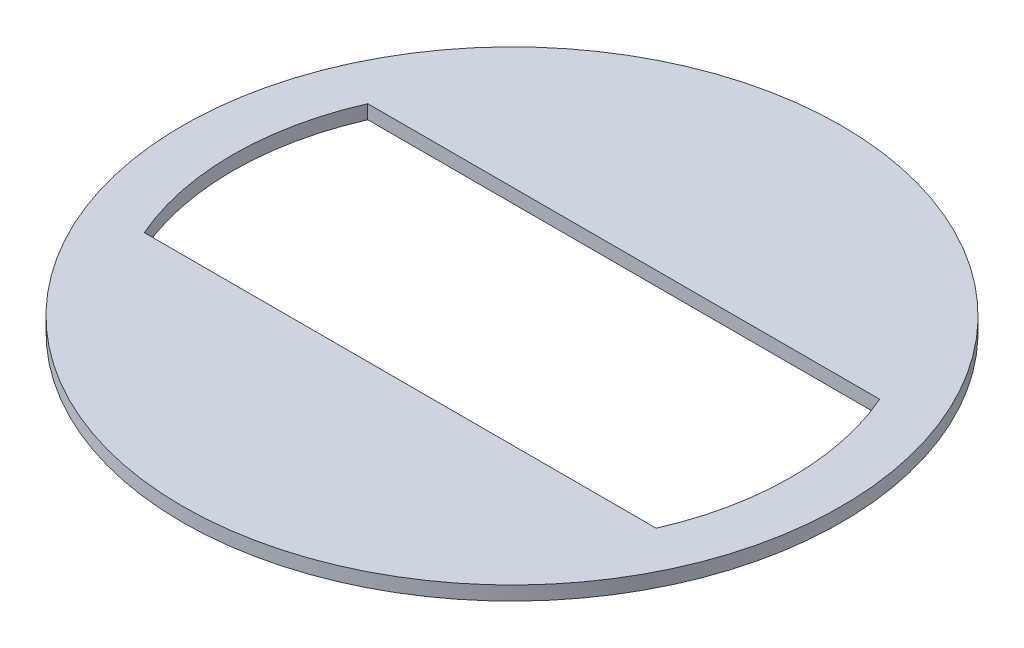
from build123d import *

# Parameters (mm, degrees)
SKETCH1_R           = 149.86
BOSS_EXTRUDE1_DEPTH = 6.35


with BuildPart() as part:
    # Sketch1 → Boss-Extrude1 (new body)
    with BuildSketch(Plane(origin=(0, 0, 0), x_dir=(1, 0, 0), z_dir=(0, 1, 0))):
        Circle(SKETCH1_R)
        with BuildLine():
            Line((-116.397422652, -50.8), (116.397422652, -50.8))
            ThreePointArc((116.397422652, -50.8), (127, 0), (116.397422652, 50.8))
            Line((116.397422652, 50.8), (-116.397422652, 50.8))
            ThreePointArc((-116.397422652, 50.8), (-127, 0), (-116.397422652, -50.8))
        make_face(mode=Mode.SUBTRACT)
    extrude(amount=BOSS_EXTRUDE1_DEPTH)


solid = part.part
